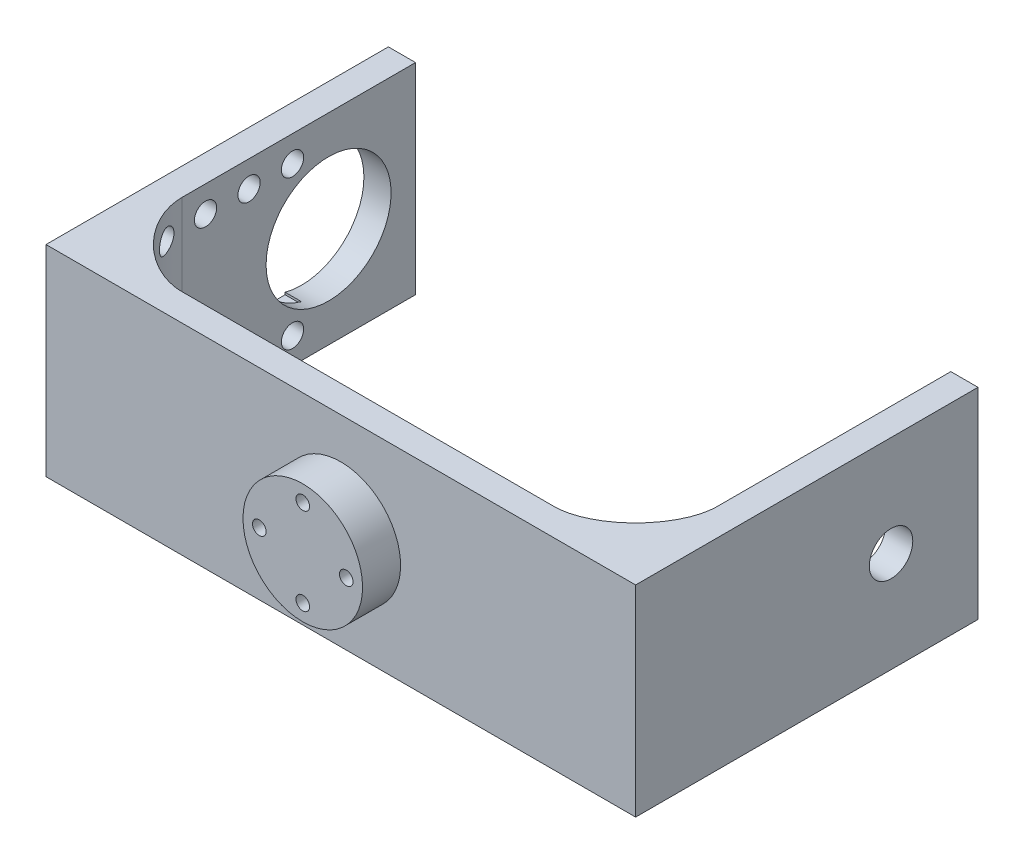
from build123d import *
from build123d.topology import SkipClean

# Parameters (mm, degrees)
BOSS_EXTRUDE3_DEPTH = 37
CUT_EXTRUDE3_REACH  = 132.806
SKETCH3_R           = 11.5
CUT_EXTRUDE4_REACH  = 132.806
SKETCH4_R           = 1.25
SKETCH6_W           = 38
SKETCH6_H           = 23
CUT_EXTRUDE6_DEPTH  = 3
SKETCH10_W          = 3
SKETCH10_H          = 23
BOSS_EXTRUDE5_DEPTH = 7.5
CUT_EXTRUDE11_REACH = 130.329
SKETCH11_R          = 1.25
SKETCH12_R          = 2.05
CUT_EXTRUDE12_DEPTH = 3
CUT_EXTRUDE13_REACH = 132.806
SKETCH13_R          = 4
FILLET5_SIZE        = 15
SKETCH14_R          = 1.25
BOSS_EXTRUDE6_DEPTH = 7
CUT_EXTRUDE14_REACH = 136.318
SKETCH15_R          = 1.25
SKETCH16_R          = 2.55
CUT_EXTRUDE15_DEPTH = 4


with BuildPart() as part:
    # Sketch2 → Boss-Extrude3 (new body)
    with BuildSketch(Plane(origin=(0, 0, 0), x_dir=(1, 0, 0), z_dir=(0, 1, 0))):
        Polygon((0, 0), (0, -63), (108.5, -63), (108.5, 0), (103.5, 0), (103.5, -58), (5, -58), (5, 0), align=None)
    extrude(amount=BOSS_EXTRUDE3_DEPTH)

    # Sketch3 → Cut-Extrude3 (cut, up to next)
    with BuildSketch(Plane.ZY, mode=Mode.PRIVATE) as cut_extrude3_sk1:
        with Locations((16, 18.5)):
            Circle(SKETCH3_R)
    cut_extrude3_tool1 = extrude(cut_extrude3_sk1.sketch, amount=-CUT_EXTRUDE3_REACH, mode=Mode.PRIVATE) & part.part
    add(cut_extrude3_tool1.solids().sort_by_distance((0, 18.5, 16))[0], mode=Mode.SUBTRACT)

    # Sketch4 → Cut-Extrude4 (cut, up to next)
    with BuildSketch(Plane.ZY, mode=Mode.PRIVATE) as cut_extrude4_sk1:
        with Locations((22.64, 32.19)):
            Circle(SKETCH4_R)
    cut_extrude4_tool1 = extrude(cut_extrude4_sk1.sketch, amount=-CUT_EXTRUDE4_REACH, mode=Mode.PRIVATE) & part.part
    # Sketch4 → Cut-Extrude4 (cut, up to next)
    with BuildSketch(Plane.ZY, mode=Mode.PRIVATE) as cut_extrude4_sk2:
        with Locations((30.64, 32.19)):
            Circle(SKETCH4_R)
    cut_extrude4_tool2 = extrude(cut_extrude4_sk2.sketch, amount=-CUT_EXTRUDE4_REACH, mode=Mode.PRIVATE) & part.part
    # Sketch4 → Cut-Extrude4 (cut, up to next)
    with BuildSketch(Plane.ZY, mode=Mode.PRIVATE) as cut_extrude4_sk3:
        with Locations((38.64, 32.19)):
            Circle(SKETCH4_R)
    cut_extrude4_tool3 = extrude(cut_extrude4_sk3.sketch, amount=-CUT_EXTRUDE4_REACH, mode=Mode.PRIVATE) & part.part
    # Sketch4 → Cut-Extrude4 (cut, up to next)
    with BuildSketch(Plane.ZY, mode=Mode.PRIVATE) as cut_extrude4_sk4:
        with Locations((46.64, 32.19)):
            Circle(SKETCH4_R)
    cut_extrude4_tool4 = extrude(cut_extrude4_sk4.sketch, amount=-CUT_EXTRUDE4_REACH, mode=Mode.PRIVATE) & part.part
    # Sketch4 → Cut-Extrude4 (cut, up to next)
    with BuildSketch(Plane.ZY, mode=Mode.PRIVATE) as cut_extrude4_sk5:
        with Locations((46.64, 4.81)):
            Circle(SKETCH4_R)
    cut_extrude4_tool5 = extrude(cut_extrude4_sk5.sketch, amount=-CUT_EXTRUDE4_REACH, mode=Mode.PRIVATE) & part.part
    # Sketch4 → Cut-Extrude4 (cut, up to next)
    with BuildSketch(Plane.ZY, mode=Mode.PRIVATE) as cut_extrude4_sk6:
        with Locations((38.64, 4.81)):
            Circle(SKETCH4_R)
    cut_extrude4_tool6 = extrude(cut_extrude4_sk6.sketch, amount=-CUT_EXTRUDE4_REACH, mode=Mode.PRIVATE) & part.part
    # Sketch4 → Cut-Extrude4 (cut, up to next)
    with BuildSketch(Plane.ZY, mode=Mode.PRIVATE) as cut_extrude4_sk7:
        with Locations((30.64, 4.81)):
            Circle(SKETCH4_R)
    cut_extrude4_tool7 = extrude(cut_extrude4_sk7.sketch, amount=-CUT_EXTRUDE4_REACH, mode=Mode.PRIVATE) & part.part
    # Sketch4 → Cut-Extrude4 (cut, up to next)
    with BuildSketch(Plane.ZY, mode=Mode.PRIVATE) as cut_extrude4_sk8:
        with Locations((22.64, 4.81)):
            Circle(SKETCH4_R)
    cut_extrude4_tool8 = extrude(cut_extrude4_sk8.sketch, amount=-CUT_EXTRUDE4_REACH, mode=Mode.PRIVATE) & part.part
    # Sketch4 → Cut-Extrude4 (cut, up to next)
    with BuildSketch(Plane.ZY, mode=Mode.PRIVATE) as cut_extrude4_sk9:
        with Locations((52.14, 26.69)):
            Circle(SKETCH4_R)
    cut_extrude4_tool9 = extrude(cut_extrude4_sk9.sketch, amount=-CUT_EXTRUDE4_REACH, mode=Mode.PRIVATE) & part.part
    # Sketch4 → Cut-Extrude4 (cut, up to next)
    with BuildSketch(Plane.ZY, mode=Mode.PRIVATE) as cut_extrude4_sk10:
        with Locations((52.14, 10.31)):
            Circle(SKETCH4_R)
    cut_extrude4_tool10 = extrude(cut_extrude4_sk10.sketch, amount=-CUT_EXTRUDE4_REACH, mode=Mode.PRIVATE) & part.part
    add(cut_extrude4_tool1.solids().sort_by_distance((0, 32.19, 22.64))[0], mode=Mode.SUBTRACT)
    add(cut_extrude4_tool2.solids().sort_by_distance((0, 32.19, 30.64))[0], mode=Mode.SUBTRACT)
    add(cut_extrude4_tool3.solids().sort_by_distance((0, 32.19, 38.64))[0], mode=Mode.SUBTRACT)
    add(cut_extrude4_tool4.solids().sort_by_distance((0, 32.19, 46.64))[0], mode=Mode.SUBTRACT)
    add(cut_extrude4_tool5.solids().sort_by_distance((0, 4.81, 46.64))[0], mode=Mode.SUBTRACT)
    add(cut_extrude4_tool6.solids().sort_by_distance((0, 4.81, 38.64))[0], mode=Mode.SUBTRACT)
    add(cut_extrude4_tool7.solids().sort_by_distance((0, 4.81, 30.64))[0], mode=Mode.SUBTRACT)
    add(cut_extrude4_tool8.solids().sort_by_distance((0, 4.81, 22.64))[0], mode=Mode.SUBTRACT)
    add(cut_extrude4_tool9.solids().sort_by_distance((0, 26.69, 52.14))[0], mode=Mode.SUBTRACT)
    add(cut_extrude4_tool10.solids().sort_by_distance((0, 10.31, 52.14))[0], mode=Mode.SUBTRACT)

    # Sketch6 → Cut-Extrude6 (cut)
    with BuildSketch(Plane.ZY):
        with Locations((38, 18.5)):
            Rectangle(SKETCH6_W, SKETCH6_H)
    extrude(amount=-CUT_EXTRUDE6_DEPTH, mode=Mode.SUBTRACT)

    # Sketch10 → Boss-Extrude5 (add)
    with BuildSketch(Plane(origin=(0, 0, 57), x_dir=(-1, 0, 0), z_dir=(0, 0, -1))):
        with Locations((-1.5, 18.5)):
            Rectangle(SKETCH10_W, SKETCH10_H)
    extrude(amount=BOSS_EXTRUDE5_DEPTH)

    # Sketch11 → Cut-Extrude11 (cut, up to next)
    with BuildSketch(Plane(origin=(3, 0, 0), x_dir=(0, 0, -1), z_dir=(1, 0, 0)), mode=Mode.PRIVATE) as cut_extrude11_sk1:
        with Locations(Location((-52.14, 26.69, 0), (0, 0, 180))):
            Circle(SKETCH11_R)
    cut_extrude11_tool1 = extrude(cut_extrude11_sk1.sketch, amount=-CUT_EXTRUDE11_REACH, mode=Mode.PRIVATE) & part.part
    # Sketch11 → Cut-Extrude11 (cut, up to next)
    with BuildSketch(Plane(origin=(3, 0, 0), x_dir=(0, 0, -1), z_dir=(1, 0, 0)), mode=Mode.PRIVATE) as cut_extrude11_sk2:
        with Locations(Location((-52.14, 10.31, 0), (0, 0, 180))):
            Circle(SKETCH11_R)
    cut_extrude11_tool2 = extrude(cut_extrude11_sk2.sketch, amount=-CUT_EXTRUDE11_REACH, mode=Mode.PRIVATE) & part.part
    add(cut_extrude11_tool1.solids().sort_by_distance((3, 26.69, 52.14))[0], mode=Mode.SUBTRACT)
    add(cut_extrude11_tool2.solids().sort_by_distance((3, 10.31, 52.14))[0], mode=Mode.SUBTRACT)

    # Sketch12 → Cut-Extrude12 (cut)
    with BuildSketch(Plane(origin=(5, 0, 0), x_dir=(0, 0, -1), z_dir=(1, 0, 0))):
        with Locations((-52.14, 26.69)):
            Circle(SKETCH12_R)
        with Locations((-46.64, 32.19)):
            Circle(SKETCH12_R)
        with Locations((-38.64, 32.19)):
            Circle(SKETCH12_R)
        with Locations((-30.64, 32.19)):
            Circle(SKETCH12_R)
        with Locations((-22.64, 32.19)):
            Circle(SKETCH12_R)
        with Locations((-30.64, 4.81)):
            Circle(SKETCH12_R)
        with Locations((-22.64, 4.81)):
            Circle(SKETCH12_R)
        with Locations((-38.64, 4.81)):
            Circle(SKETCH12_R)
        with Locations((-46.64, 4.81)):
            Circle(SKETCH12_R)
        with Locations((-52.14, 10.31)):
            Circle(SKETCH12_R)
    extrude(amount=-CUT_EXTRUDE12_DEPTH, mode=Mode.SUBTRACT)

    # Sketch13 → Cut-Extrude13 (cut, up to next)
    with BuildSketch(Plane(origin=(108.5, 0, 0), x_dir=(0, 0, -1), z_dir=(1, 0, 0)), mode=Mode.PRIVATE) as cut_extrude13_sk1:
        with Locations((-16, 18.5)):
            Circle(SKETCH13_R)
    cut_extrude13_tool1 = extrude(cut_extrude13_sk1.sketch, amount=-CUT_EXTRUDE13_REACH, mode=Mode.PRIVATE) & part.part
    add(cut_extrude13_tool1.solids().sort_by_distance((108.5, 18.5, 16))[0], mode=Mode.SUBTRACT)

    # Fillet5
    # a fillet whose section is not a circle: 15 mm, written as the material it adds along each edge
    with BuildSketch(Plane(origin=(103.5, 0, 58), x_dir=(0, 0, -1), z_dir=(0, 1, 0))) as fillet5_piece_1:
        with BuildLine():
            Bezier((FILLET5_SIZE, 0), (0, 0), (0, FILLET5_SIZE), weights=[1, 0.538461538, 1])
            Line((0, FILLET5_SIZE), (0, 0))
            Line((0, 0), (FILLET5_SIZE, 0))
        make_face()
    extrude(amount=37)
    with BuildSketch(Plane(origin=(5, 0, 58), x_dir=(0, 0, -1), z_dir=(0, 1, 0))) as fillet5_piece_2_section:
        with BuildLine():
            Bezier((FILLET5_SIZE, 0), (0, 0), (0, -FILLET5_SIZE), weights=[1, 0.538461538, 1])
            Line((0, -FILLET5_SIZE), (0, 0))
            Line((0, 0), (FILLET5_SIZE, 0))
        make_face()
    fillet5_piece_2 = extrude(amount=37, mode=Mode.PRIVATE)
    fillet5_piece_2 = fillet5_piece_2 - Plane(origin=(5, 32.19, 46.64), x_dir=(0, 0, -1), z_dir=(1, 0, 0)) * Cylinder(2.05, 135, mode=Mode.PRIVATE)
    fillet5_piece_2 = fillet5_piece_2 - Plane(origin=(5, 26.69, 52.14), x_dir=(0, 0, -1), z_dir=(1, 0, 0)) * Cylinder(2.05, 135, mode=Mode.PRIVATE)
    fillet5_piece_2 = fillet5_piece_2 - Plane(origin=(5, 10.31, 52.14), x_dir=(0, 0, -1), z_dir=(1, 0, 0)) * Cylinder(2.05, 135, mode=Mode.PRIVATE)
    fillet5_piece_2 = fillet5_piece_2 - Plane(origin=(5, 4.81, 46.64), x_dir=(0, 0, -1), z_dir=(1, 0, 0)) * Cylinder(2.05, 135, mode=Mode.PRIVATE)
    add(fillet5_piece_2)

    # Sketch14 → Boss-Extrude6 (add)
    # profile 1 of 2: a face of its own
    with BuildSketch(Plane.XY.offset(63)):
        with BuildLine():
            Line((54.25, 27.75), (54.25, 29.5))
            ThreePointArc((54.25, 29.5), (43.25, 18.5), (54.25, 7.5))
            Line((54.25, 7.5), (54.25, 9.25))
            ThreePointArc((54.25, 9.25), (53, 10.5), (54.25, 11.75))
            Line((54.25, 11.75), (54.25, 25.25))
            ThreePointArc((54.25, 25.25), (53, 26.5), (54.25, 27.75))
        make_face()
        with Locations((46.25, 18.5)):
            Circle(SKETCH14_R, mode=Mode.SUBTRACT)
    # profile 2 of 2: a face of its own
    with BuildSketch(Plane.XY.offset(63)):
        with BuildLine():
            ThreePointArc((65.25, 18.5), (62.028174593, 26.278174593), (54.25, 29.5))
            Line((54.25, 29.5), (54.25, 27.75))
            ThreePointArc((54.25, 27.75), (55.133883476, 27.383883476), (55.5, 26.5))
            ThreePointArc((55.5, 26.5), (55.133883476, 25.616116524), (54.25, 25.25))
            Line((54.25, 25.25), (54.25, 11.75))
            ThreePointArc((54.25, 11.75), (55.133883476, 11.383883476), (55.5, 10.5))
            ThreePointArc((55.5, 10.5), (55.133883476, 9.616116524), (54.25, 9.25))
            Line((54.25, 9.25), (54.25, 7.5))
            ThreePointArc((54.25, 7.5), (62.028174593, 10.721825407), (65.25, 18.5))
        make_face()
        with Locations((62.25, 18.5)):
            Circle(SKETCH14_R, mode=Mode.SUBTRACT)
    extrude(amount=BOSS_EXTRUDE6_DEPTH)

    # Sketch15 → Cut-Extrude14 (cut, up to next)
    with BuildSketch(Plane.XY.offset(70), mode=Mode.PRIVATE) as cut_extrude14_sk1:
        with Locations((54.25, 10.5)):
            Circle(SKETCH15_R)
    cut_extrude14_tool1 = extrude(cut_extrude14_sk1.sketch, amount=-CUT_EXTRUDE14_REACH, mode=Mode.PRIVATE) & part.part
    # Sketch15 → Cut-Extrude14 (cut, up to next)
    with BuildSketch(Plane.XY.offset(70), mode=Mode.PRIVATE) as cut_extrude14_sk2:
        with Locations((46.25, 18.5)):
            Circle(SKETCH15_R)
    cut_extrude14_tool2 = extrude(cut_extrude14_sk2.sketch, amount=-CUT_EXTRUDE14_REACH, mode=Mode.PRIVATE) & part.part
    # Sketch15 → Cut-Extrude14 (cut, up to next)
    with BuildSketch(Plane.XY.offset(70), mode=Mode.PRIVATE) as cut_extrude14_sk3:
        with Locations((54.25, 26.5)):
            Circle(SKETCH15_R)
    cut_extrude14_tool3 = extrude(cut_extrude14_sk3.sketch, amount=-CUT_EXTRUDE14_REACH, mode=Mode.PRIVATE) & part.part
    # Sketch15 → Cut-Extrude14 (cut, up to next)
    with BuildSketch(Plane.XY.offset(70), mode=Mode.PRIVATE) as cut_extrude14_sk4:
        with Locations((62.25, 18.5)):
            Circle(SKETCH15_R)
    cut_extrude14_tool4 = extrude(cut_extrude14_sk4.sketch, amount=-CUT_EXTRUDE14_REACH, mode=Mode.PRIVATE) & part.part
    add(cut_extrude14_tool1.solids().sort_by_distance((54.25, 10.5, 70))[0], mode=Mode.SUBTRACT)
    add(cut_extrude14_tool2.solids().sort_by_distance((46.25, 18.5, 70))[0], mode=Mode.SUBTRACT)
    add(cut_extrude14_tool3.solids().sort_by_distance((54.25, 26.5, 70))[0], mode=Mode.SUBTRACT)
    add(cut_extrude14_tool4.solids().sort_by_distance((62.25, 18.5, 70))[0], mode=Mode.SUBTRACT)

    # Sketch16 → Cut-Extrude15 (cut)
    with SkipClean():  # the faces are left unmerged after this step: merging them gives an invalid solid
        with BuildSketch(Plane(origin=(0, 0, 58), x_dir=(-1, 0, 0), z_dir=(0, 0, -1))):
            with Locations((-46.25, 18.5)):
                Circle(SKETCH16_R)
            with Locations((-54.25, 10.5)):
                Circle(SKETCH16_R)
            with Locations((-62.25, 18.5)):
                Circle(SKETCH16_R)
            with Locations((-54.25, 26.5)):
                Circle(SKETCH16_R)
        extrude(amount=-CUT_EXTRUDE15_DEPTH, mode=Mode.SUBTRACT)


solid = part.part
